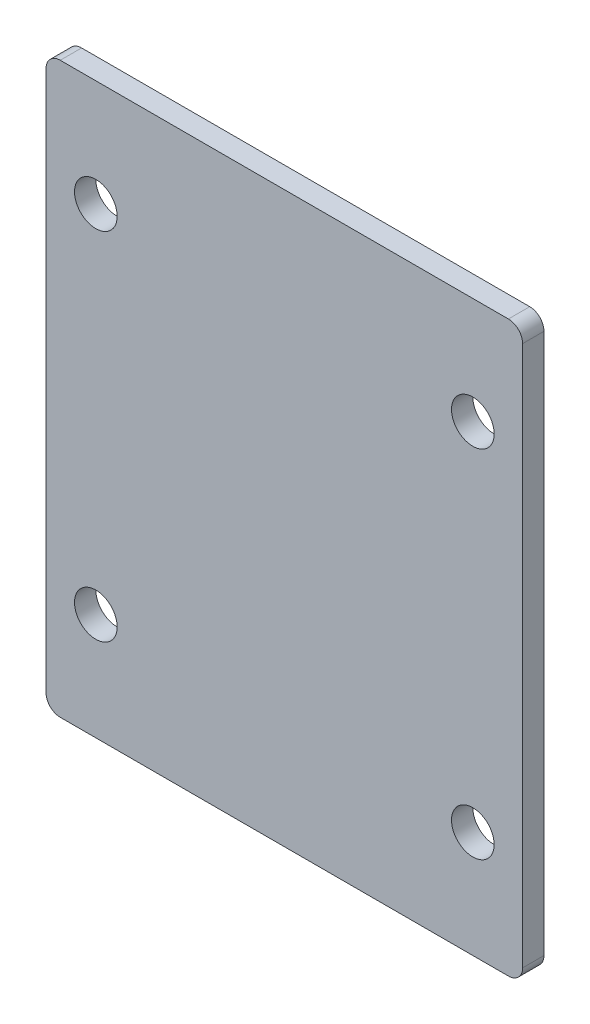
from build123d import *

# Parameters (mm, degrees)
SKETCH2_W          = 33.5
SKETCH2_H          = 40
SKETCH2_R          = 1.5
BASE_FLANGE1_DEPTH = 1.5
FILLET1_R          = 1


# Sheet-metal steps are written as plain solids
with BuildPart() as part:
    # Sketch2 → Base-Flange1 (new body)
    with BuildSketch(Plane.XY):
        with Locations((275.329860694, 200.707229453)):
            Rectangle(SKETCH2_W, SKETCH2_H)
        with Locations((288.579860694, 213.207229453)):
            Circle(SKETCH2_R, mode=Mode.SUBTRACT)
        with Locations((288.579860694, 188.207229453)):
            Circle(SKETCH2_R, mode=Mode.SUBTRACT)
        with Locations((262.079860694, 213.207229453)):
            Circle(SKETCH2_R, mode=Mode.SUBTRACT)
        with Locations((262.079860694, 188.207229453)):
            Circle(SKETCH2_R, mode=Mode.SUBTRACT)
    extrude(amount=-BASE_FLANGE1_DEPTH)

    # Fillet1
    fillet1_edges = [part.edges().sort_by_distance(p)[0] for p in [
        (258.579860694, 220.707229453, -0.75),
        (292.079860694, 220.707229453, -0.75),
        (292.079860694, 180.707229453, -0.75),
        (258.579860694, 180.707229453, -0.75),
    ]]
    fillet(fillet1_edges, radius=FILLET1_R)


solid = part.part
